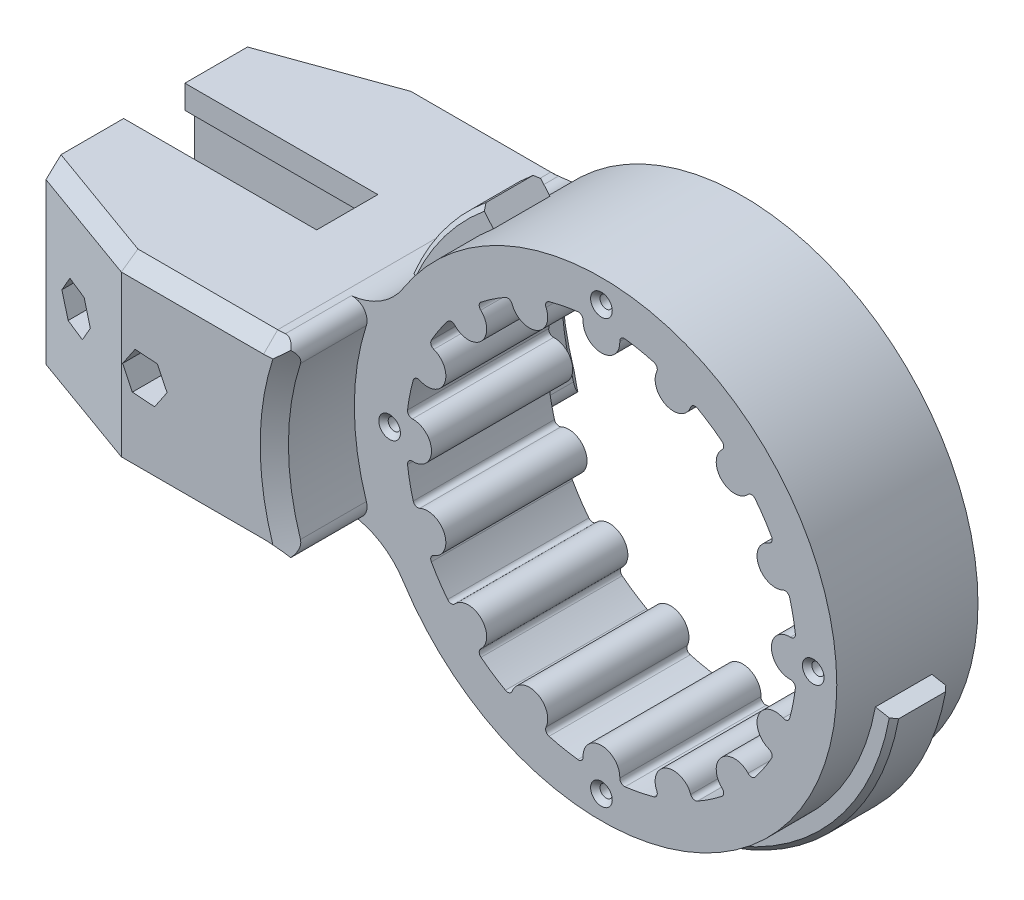
from build123d import *

# Parameters (mm, degrees)
SKETCH1_R           = 50
BOSS_EXTRUDE1_DEPTH = 30
BOSS_EXTRUDE2_DEPTH = 30
BOSS_EXTRUDE3_DEPTH = 17
BOSS_EXTRUDE4_START = 17
BOSS_EXTRUDE4_DEPTH = 17
SKETCH7_W           = 82
SKETCH7_H           = 12.999999999999998
CUT_EXTRUDE3_DEPTH  = 139.59653675326814
CUT_EXTRUDE4_DEPTH  = 139.59653675326814
FILLET3_R           = 15
CUT_EXTRUDE5_DEPTH  = 41
SKETCH11_R          = 2.750000000000008
CUT_EXTRUDE6_DEPTH  = 137.7333170810977
SKETCH12_R          = 4.599999999999999
SKETCH12_R_2        = 4.600000000000013
CUT_EXTRUDE7_DEPTH  = 12
CUT_EXTRUDE8_DEPTH  = 12
CHAMFER1_SIZE       = 3
CHAMFER2_SIZE       = 3
FILLET5_R           = 3
SKETCH17_R          = 1.3000000000000016
SKETCH17_R_2        = 1.3000000000000007
CUT_EXTRUDE10_DEPTH = 93.00000000000003
CHAMFER3_SIZE       = 1
SKETCH25_R          = 54.00000000000001
SKETCH25_R_2        = 50
BOSS_EXTRUDE8_DEPTH = 6
CUT_EXTRUDE12_START = -15
CUT_EXTRUDE12_DEPTH = 15
CHAMFER4_SIZE       = 1
CUT_EXTRUDE13_DEPTH = 132.24404756102277
FILLET6_R           = 1


with BuildPart() as part:
    # Sketch1 → Boss-Extrude1 (new body)
    with BuildSketch(Plane.XY):
        Circle(SKETCH1_R)
    extrude(amount=BOSS_EXTRUDE1_DEPTH)

    # Sketch4 → Boss-Extrude2 (add)
    with BuildSketch(Plane(origin=(0, 0, 0), x_dir=(-1, 0, 0), z_dir=(0, 0, -1))):
        with BuildLine():
            Line((45.825756949558404, -19.999999999999993), (110, -19.999999999999993))
            Line((110, -19.999999999999993), (110, 20.000000000000007))
            Line((110, 20.000000000000007), (45.8257569495584, 20.000000000000007))
            ThreePointArc((45.8257569495584, 20.000000000000007), (50, 8.33e-15), (45.825756949558404, -19.999999999999993))
        make_face()
    extrude(amount=-BOSS_EXTRUDE2_DEPTH)

    # Sketch5 → Boss-Extrude3 (add)
    with BuildSketch(Plane(origin=(0, 0, 0), x_dir=(-1, 0, 0), z_dir=(0, 0, -1))):
        with BuildLine():
            Line((110, -20), (110, 20))
            Line((110, 20), (48.541219597369, 20))
            ThreePointArc((48.541219597369, 20), (52.5, 0), (48.541219597369, -20))
            Line((48.541219597369, -20), (110, -20))
        make_face()
    extrude(amount=BOSS_EXTRUDE3_DEPTH)

    # Sketch6 → Boss-Extrude4 (add)
    with BuildSketch(Plane.XY.offset(30).offset(BOSS_EXTRUDE4_START)):
        with BuildLine():
            Line((-110, -20), (-48.541219597369, -20))
            ThreePointArc((-48.541219597369, -20), (-52.49999999999999, 6.43e-15), (-48.541219597368986, 20.00000000000001))
            Line((-48.541219597368986, 20.00000000000001), (-110.00000000000001, 20))
            Line((-110.00000000000001, 20), (-110, -20))
        make_face()
    extrude(amount=-BOSS_EXTRUDE4_DEPTH)

    # Sketch7 → Cut-Extrude3 (cut, through all)
    with BuildSketch(Plane(origin=(0, 20.000000000000007, 0), x_dir=(1, -1.3e-16, 0), z_dir=(1.3e-16, 1, 0))):
        with Locations((-110, -15)):
            Rectangle(SKETCH7_W, SKETCH7_H)
    extrude(amount=-CUT_EXTRUDE3_DEPTH, mode=Mode.SUBTRACT)

    # Sketch8 → Cut-Extrude4 (cut, through all)
    with BuildSketch(Plane(origin=(0, 20.000000000000007, 0), x_dir=(1, -1.3e-16, 0), z_dir=(1.3e-16, 1, 0))):
        Polygon((-110, 7.999999999999993), (-84.99999999999999, 16.999999999999996), (-110, 17), align=None)
        Polygon((-110.00000000000001, -38), (-85.00000000000001, -47), (-110.00000000000001, -47), align=None)
    extrude(amount=-CUT_EXTRUDE4_DEPTH, mode=Mode.SUBTRACT)

    # Fillet3
    # the kernel refuses this fillet: 15 mm, written as the material it adds along each edge
    with BuildSketch(Plane(origin=(-45.8257569495584, 20, -22.366247002395987), x_dir=(0.4706819799132327, 0.8823029376495123, 0), z_dir=(0, 0, 1))) as fillet3_piece_1_section:
        with BuildLine():
            CenterArc((9.023588295816216, 14.953751872461773), FILLET3_R, 208.07857443550242, 57.42102960719643)
            Line((-4.210955768926529, 7.893522173763395), (0, 0))
            ThreePointArc((0, 0), (3.9232992590505327, 0.154160425127419), (7.846598518101046, -5e-17))
        make_face()
    fillet3_piece_1 = extrude(amount=52.36624700239599, mode=Mode.PRIVATE)
    fillet3_piece_1 = split(fillet3_piece_1, bisect_by=Plane(origin=(-50.49351754230909, 20.262771786898075, 0), z_dir=(0, 0, -1)), keep=Keep.TOP, mode=Mode.PRIVATE)
    fillet3_piece_1 = split(fillet3_piece_1, bisect_by=Plane(origin=(-50.49351754230909, 20.262771786898075, -17), z_dir=(0, 0, 1)), keep=Keep.TOP, mode=Mode.PRIVATE)
    fillet3_piece_1 = fillet3_piece_1 - Plane(origin=(-3.197e-14, -8.9e-16, -8.499999999998765), x_dir=(-0.9245946589975046, 0.38095238095238115, 0), z_dir=(0, 0, 1)) * Cylinder(52.49999999999997, 137, mode=Mode.PRIVATE)
    add(fillet3_piece_1)
    with BuildSketch(Plane(origin=(-45.8257569495584, 20.000000000000007, 0), x_dir=(0.4706819799132331, 0.8823029376495122, 0), z_dir=(0, 0, 1))) as fillet3_piece_2_section:
        with BuildLine():
            CenterArc((9.023588295816205, 14.953751872461773), FILLET3_R, 208.07857443550242, 57.42102960719643)
            Line((-4.210955768926539, 7.89352217376339), (0, 0))
            ThreePointArc((0, 0), (3.923299259050527, 0.15416042512741726), (7.8465985181010405, -2.6e-16))
        make_face()
    fillet3_piece_2 = extrude(amount=30, mode=Mode.PRIVATE)
    fillet3_piece_2 = fillet3_piece_2 & Plane(origin=(-3.197e-14, -8.9e-16, 14.999999999999996), x_dir=(-0.9245946589975046, 0.38095238095238115, 0), z_dir=(0, 0, 1)) * Cylinder(52.49999999999997, 92, mode=Mode.PRIVATE)
    add(fillet3_piece_2)
    with BuildSketch(Plane(origin=(-45.8257569495584, 20.000000000000007, 0), x_dir=(0.4706819799132331, 0.8823029376495122, 0), z_dir=(0, 0, 1))) as fillet3_piece_3_section:
        with BuildLine():
            CenterArc((9.023588295816205, 14.953751872461773), FILLET3_R, 208.07857443550242, 57.42102960719643)
            Line((-4.210955768926539, 7.89352217376339), (0, 0))
            ThreePointArc((0, 0), (3.923299259050527, 0.15416042512741726), (7.8465985181010405, -2.6e-16))
        make_face()
    fillet3_piece_3 = extrude(amount=30, mode=Mode.PRIVATE)
    fillet3_piece_3 = fillet3_piece_3 - Plane(origin=(-3.197e-14, -8.9e-16, 15), x_dir=(-0.9245946589975046, 0.38095238095238115, 0), z_dir=(0, 0, 1)) * Cylinder(52.49999999999997, 92, mode=Mode.PRIVATE)
    add(fillet3_piece_3)
    with BuildSketch(Plane(origin=(-45.8257569495584, 20.000000000000007, 0), x_dir=(0.4706819799132331, 0.8823029376495122, 0), z_dir=(0, 0, 1))) as fillet3_piece_4_section:
        with BuildLine():
            CenterArc((9.023588295816205, 14.953751872461773), FILLET3_R, 208.07857443550242, 57.42102960719643)
            Line((-4.210955768926539, 7.89352217376339), (0, 0))
            ThreePointArc((0, 0), (3.923299259050527, 0.15416042512741726), (7.8465985181010405, -2.6e-16))
        make_face()
    fillet3_piece_4 = extrude(amount=52.366247002395994, mode=Mode.PRIVATE)
    fillet3_piece_4 = split(fillet3_piece_4, bisect_by=Plane(origin=(-50.49351754230926, 20.26277178689822, 30), z_dir=(0, 0, 1)), keep=Keep.TOP, mode=Mode.PRIVATE)
    fillet3_piece_4 = split(fillet3_piece_4, bisect_by=Plane(origin=(-50.49351754230926, 20.26277178689822, 47), z_dir=(0, 0, -1)), keep=Keep.TOP, mode=Mode.PRIVATE)
    fillet3_piece_4 = fillet3_piece_4 - Plane(origin=(-3.197e-14, -8.9e-16, 38.5), x_dir=(-0.9245946589975046, 0.38095238095238115, 0), z_dir=(0, 0, 1)) * Cylinder(52.49999999999997, 137, mode=Mode.PRIVATE)
    add(fillet3_piece_4)
    with BuildSketch(Plane(origin=(-45.825756949558404, -19.999999999999986, -22.366247002395934), x_dir=(0.4706819799132334, -0.882302937649512, 0), z_dir=(0, 0, 1))) as fillet3_piece_5_section:
        with BuildLine():
            CenterArc((9.023588295816205, -14.95375187246178), FILLET3_R, 94.50039595730111, 57.42102960719639)
            Line((-4.210955768926525, -7.8935221737633725), (0, 0))
            ThreePointArc((0, 0), (3.923299259050514, -0.1541604251274201), (7.846598518101049, -6e-17))
        make_face()
    fillet3_piece_5 = extrude(amount=52.36624700239594, mode=Mode.PRIVATE)
    fillet3_piece_5 = split(fillet3_piece_5, bisect_by=Plane(origin=(-50.49351754230909, -20.262771786898064, 0), z_dir=(0, 0, -1)), keep=Keep.TOP, mode=Mode.PRIVATE)
    fillet3_piece_5 = fillet3_piece_5 - Plane(origin=(-3.197e-14, -8.9e-16, -8.499999999998773), x_dir=(-0.9245946589975046, 0.38095238095238115, 0), z_dir=(0, 0, 1)) * Cylinder(52.49999999999997, 137, mode=Mode.PRIVATE)
    fillet3_piece_5 = split(fillet3_piece_5, bisect_by=Plane(origin=(-50.49351754230909, -20.262771786898064, -17), z_dir=(0, 0, 1)), keep=Keep.TOP, mode=Mode.PRIVATE)
    add(fillet3_piece_5)
    with BuildSketch(Plane(origin=(-45.825756949558404, -19.999999999999993, 0), x_dir=(0.47068197991323374, -0.8823029376495117, 0), z_dir=(0, 0, 1))) as fillet3_piece_6_section:
        with BuildLine():
            CenterArc((9.023588295816191, -14.95375187246178), FILLET3_R, 94.50039595730107, 57.421029607196374)
            Line((-4.210955768926534, -7.893522173763367), (0, 0))
            ThreePointArc((0, 0), (3.9232992590505074, -0.15416042512741837), (7.846598518101043, 9e-17))
        make_face()
    fillet3_piece_6 = extrude(amount=30, mode=Mode.PRIVATE)
    fillet3_piece_6 = fillet3_piece_6 & Plane(origin=(-3.197e-14, -8.9e-16, 15.000000000000002), x_dir=(-0.9245946589975046, 0.38095238095238115, 0), z_dir=(0, 0, 1)) * Cylinder(52.49999999999997, 92, mode=Mode.PRIVATE)
    add(fillet3_piece_6)
    with BuildSketch(Plane(origin=(-45.825756949558404, -19.999999999999993, 0), x_dir=(0.47068197991323374, -0.8823029376495117, 0), z_dir=(0, 0, 1))) as fillet3_piece_7_section:
        with BuildLine():
            CenterArc((9.023588295816191, -14.95375187246178), FILLET3_R, 94.50039595730107, 57.421029607196374)
            Line((-4.210955768926534, -7.893522173763367), (0, 0))
            ThreePointArc((0, 0), (3.9232992590505074, -0.15416042512741837), (7.846598518101043, 9e-17))
        make_face()
    fillet3_piece_7 = extrude(amount=30, mode=Mode.PRIVATE)
    fillet3_piece_7 = fillet3_piece_7 - Plane(origin=(-3.197e-14, -8.9e-16, 15.000000000000002), x_dir=(-0.9245946589975046, 0.38095238095238115, 0), z_dir=(0, 0, 1)) * Cylinder(52.49999999999997, 92, mode=Mode.PRIVATE)
    add(fillet3_piece_7)
    with BuildSketch(Plane(origin=(-45.825756949558404, -19.999999999999993, 0), x_dir=(0.47068197991323374, -0.8823029376495117, 0), z_dir=(0, 0, 1))) as fillet3_piece_8_section:
        with BuildLine():
            CenterArc((9.023588295816191, -14.95375187246178), FILLET3_R, 94.50039595730107, 57.421029607196374)
            Line((-4.210955768926534, -7.893522173763367), (0, 0))
            ThreePointArc((0, 0), (3.9232992590505074, -0.15416042512741837), (7.846598518101043, 9e-17))
        make_face()
    fillet3_piece_8 = extrude(amount=52.36624700239594, mode=Mode.PRIVATE)
    fillet3_piece_8 = split(fillet3_piece_8, bisect_by=Plane(origin=(-50.493517542309256, -20.262771786898217, 30), z_dir=(0, 0, 1)), keep=Keep.TOP, mode=Mode.PRIVATE)
    fillet3_piece_8 = fillet3_piece_8 - Plane(origin=(-3.197e-14, -8.9e-16, 38.5), x_dir=(-0.9245946589975046, 0.38095238095238115, 0), z_dir=(0, 0, 1)) * Cylinder(52.49999999999997, 137, mode=Mode.PRIVATE)
    fillet3_piece_8 = split(fillet3_piece_8, bisect_by=Plane(origin=(-50.493517542309256, -20.262771786898217, 47), z_dir=(0, 0, -1)), keep=Keep.TOP, mode=Mode.PRIVATE)
    add(fillet3_piece_8)

    # Sketch10 → Cut-Extrude5 (cut)
    with BuildSketch(Plane.ZY.offset(110)):
        Polygon((6.500000000000009, 15.000000000000007), (23.499999999999993, 15.000000000000005), (23.499999999999993, -14.999999999999998), (6.500000000000009, -14.999999999999993), align=None)
    extrude(amount=-CUT_EXTRUDE5_DEPTH, mode=Mode.SUBTRACT)

    # Sketch11 → Cut-Extrude6 (cut, through all)
    with BuildSketch(Plane(origin=(0, 0, -17), x_dir=(-1, 0, 0), z_dir=(0, 0, -1))):
        with Locations((100.00000000000001, -3.67e-15)):
            Circle(SKETCH11_R)
        with Locations((80.00000000000001, -6.12e-15)):
            Circle(SKETCH11_R)
    extrude(amount=-CUT_EXTRUDE6_DEPTH, mode=Mode.SUBTRACT)

    # Sketch12 → Cut-Extrude7 (cut)
    with BuildSketch(Plane(origin=(0, 0, -17), x_dir=(-1, 0, 0), z_dir=(0, 0, -1))):
        with Locations((80.00000000000001, -6.12e-15)):
            Circle(SKETCH12_R)
        with Locations((100.00000000000001, -3.67e-15)):
            Circle(SKETCH12_R_2)
    extrude(amount=-CUT_EXTRUDE7_DEPTH, mode=Mode.SUBTRACT)

    # Sketch13 → Cut-Extrude8 (cut)
    with BuildSketch(Plane.XY.offset(47)):
        Polygon((-104.72243583501142, 0.33456407089449847), (-102.65095890209392, -3.9224673654145854), (-97.92852306708252, -4.257031436309101), (-95.27756416498866, -0.33456407089451495), (-97.34904109790615, 3.922467365414601), (-102.07147693291752, 4.2570314363091155), align=None)
        Polygon((-84.72243583501141, 0.3345640708945193), (-82.6509589020939, -3.9224673654145708), (-77.92852306708252, -4.257031436309093), (-75.27756416498863, -0.3345640708945236), (-77.34904109790615, 3.922467365414575), (-82.07147693291752, 4.257031436309095), align=None)
    extrude(amount=-CUT_EXTRUDE8_DEPTH, mode=Mode.SUBTRACT)

    # Chamfer1
    chamfer1_edges = [part.edges().sort_by_distance(p)[0] for p in [
        (-51.179484310863074, 20.43662149834451, 47),
        (-51.17948431086295, -20.436621498344543, 47),
        (-52.5, 1.066e-14, 47),
        (-69.88612787525821, -20, 47),
        (-97.5, -19.999999999999993, 42.49999999999999),
        (-97.50000000000001, 20.00000000000002, 42.5),
        (-69.88612787525827, 20.000000000000007, 47),
    ]]
    chamfer(chamfer1_edges, length=CHAMFER1_SIZE)

    # Chamfer2
    chamfer2_edges = [part.edges().sort_by_distance(p)[0] for p in [
        (-51.17948431086295, -20.436621498344543, -17),
        (-52.5, 9.77e-15, -17),
        (-69.88612787525827, 20, -17),
        (-97.49999999999999, -19.999999999999993, -12.499999999999996),
        (-97.5, 20.00000000000002, -12.499999999999995),
        (-69.8861278752582, -20, -17),
        (-51.179484310863074, 20.43662149834451, -17),
    ]]
    chamfer(chamfer2_edges, length=CHAMFER2_SIZE)

    # Fillet5
    fillet5_edges = [part.edges().sort_by_distance(p)[0] for p in [
        (-47.79587037110309, -21.721067549011234, -7),
        (-47.79587037110309, -21.721067549011234, 37),
        (-47.79587037110309, 21.721067549011234, -7),
        (-47.79587037110309, 21.721067549011234, 37),
    ]]
    fillet(fillet5_edges, radius=FILLET5_R)

    # Sketch17 → Cut-Extrude10 (cut)
    with BuildSketch(Plane.XY.offset(30)):
        with Locations((-45, 0)):
            Circle(SKETCH17_R)
        with Locations((-2.76e-15, 45)):
            Circle(SKETCH17_R_2)
        with Locations((45, 5.51e-15)):
            Circle(SKETCH17_R)
        with Locations((8.27e-15, -45)):
            Circle(SKETCH17_R_2)
    extrude(amount=-CUT_EXTRUDE10_DEPTH, mode=Mode.SUBTRACT)

    # Chamfer3
    chamfer3_edges = [part.edges().sort_by_distance(p)[0] for p in [
        (-46.300000000000004, -4.2e-16, 30),
        (-1.3000000000000034, 45, 30),
        (43.699999999999996, 5.09e-15, 30),
        (-1.2999999999999925, -45, 30),
    ]]
    chamfer(chamfer3_edges, length=CHAMFER3_SIZE)

    # Sketch25 → Boss-Extrude8 (add, symmetric)
    with BuildSketch(Plane.XY.offset(15)):
        Circle(SKETCH25_R)
        Circle(SKETCH25_R_2, mode=Mode.SUBTRACT)
    extrude(amount=BOSS_EXTRUDE8_DEPTH, both=True)

    # Sketch26 → Cut-Extrude12 (cut)
    with BuildSketch(Plane.XY.offset(20.999999999999996).offset(CUT_EXTRUDE12_START)):
        with BuildLine():
            Line((53.13418555816767, -9.631112348540338), (49.198319961266364, -8.91769661901883))
            ThreePointArc((49.198319961266364, -8.91769661901883), (25.20671015183375, 43.181266346894475), (-31.95591472346896, 38.455422428916066))
            Line((-31.95591472346896, 38.455422428916066), (-34.51238790134648, 41.53185622322934))
            ThreePointArc((-34.51238790134648, 41.53185622322934), (27.22324696398045, 46.63576765464603), (53.13418555816767, -9.631112348540338))
        make_face()
    extrude(amount=CUT_EXTRUDE12_DEPTH, mode=Mode.SUBTRACT)

    # Chamfer4
    chamfer4_edges = [part.edges().sort_by_distance(p)[0] for p in [
        (5.846200759408857, -53.6826036689791, 21),
        (5.8462007594098395, -53.68260366897899, 9),
        (-43.414386383861704, 32.11216365978419, 9),
        (-43.41438638386222, 32.1121636597835, 21),
    ]]
    chamfer(chamfer4_edges, length=CHAMFER4_SIZE)

    # Sketch27 → Cut-Extrude13 (cut, through all)
    with BuildSketch(Plane.XY.offset(30)):
        with BuildLine():
            ThreePointArc((-41.33799999999999, -3.6632985136349734), (-36.09999999999998, 0), (-41.33799999999999, 3.6632985136349734))
            ThreePointArc((-41.33799999999999, 3.6632985136349734), (-40.70258913673405, 8.096248363669334), (-39.59321576392731, 12.43492120888174))
            ThreePointArc((-39.59321576392731, 12.43492120888174), (-33.352051123657425, 13.814871908379772), (-36.78944846597579, 19.203814245334485))
            ThreePointArc((-36.78944846597579, 19.203814245334485), (-34.505988910555594, 23.056164670313528), (-31.820723341191343, 26.64003690018766))
            ThreePointArc((-31.820723341191343, 26.64003690018766), (-25.526554800835093, 25.526554800833708), (-26.640036900188544, 31.820723341190607))
            ThreePointArc((-26.640036900188544, 31.820723341190607), (-23.05616467031391, 34.505988910555345), (-19.203814245334275, 36.789448465975894))
            ThreePointArc((-19.203814245334275, 36.789448465975894), (-13.814871908380718, 33.352051123656665), (-12.434921208883269, 39.59321576392684))
            ThreePointArc((-12.434921208883269, 39.59321576392684), (-8.096248363670052, 40.70258913673391), (-3.663298513634829, 41.338))
            ThreePointArc((-3.663298513634829, 41.338), (-1.12863e-12, 36.09999999999883), (3.6632985136331393, 41.338000000000164))
            ThreePointArc((3.6632985136331393, 41.338000000000164), (8.096248363668556, 40.70258913673421), (12.434921208881963, 39.59321576392725))
            ThreePointArc((12.434921208881963, 39.59321576392725), (13.814871908378183, 33.35205112365597), (19.20381424533285, 36.78944846597663))
            ThreePointArc((19.20381424533285, 36.78944846597663), (23.056164670312832, 34.505988910556056), (26.64003690018777, 31.820723341191243))
            ThreePointArc((26.64003690018777, 31.820723341191243), (25.526554800832038, 25.526554800832546), (31.820723341190405, 26.640036900188786))
            ThreePointArc((31.820723341190405, 26.640036900188786), (34.50598891055528, 23.05616467031398), (36.78944846597595, 19.203814245334144))
            ThreePointArc((36.78944846597595, 19.203814245334144), (33.35205112365423, 13.814871908378157), (39.59321576392702, 12.434921208882718))
            ThreePointArc((39.59321576392702, 12.434921208882718), (40.70258913673413, 8.096248363668986), (41.33800000000015, 3.663298513633235))
            ThreePointArc((41.33800000000015, 3.663298513633235), (36.09999999999716, -3.912e-13), (41.33799999999996, -3.6632985136352625))
            ThreePointArc((41.33799999999996, -3.6632985136352625), (40.70258913673382, -8.096248363670547), (39.59321576392667, -12.434921208883813))
            ThreePointArc((39.59321576392667, -12.434921208883813), (33.35205112365465, -13.81487190837967), (36.78944846597569, -19.203814245334666))
            ThreePointArc((36.78944846597569, -19.203814245334666), (34.50598891055488, -23.056164670314615), (31.820723341189822, -26.64003690018949))
            ThreePointArc((31.820723341189822, -26.64003690018949), (25.526554800831782, -25.52655480083383), (26.640036900187322, -31.82072334119162))
            ThreePointArc((26.640036900187322, -31.82072334119162), (23.05616467031232, -34.50598891055641), (19.203814245332282, -36.78944846597694))
            ThreePointArc((19.203814245332282, -36.78944846597694), (13.814871908377526, -33.352051123656544), (12.43492120888131, -39.593215763927454))
            ThreePointArc((12.43492120888131, -39.593215763927454), (8.096248363668016, -40.702589136734325), (3.6632985136327427, -41.33800000000019))
            ThreePointArc((3.6632985136327427, -41.33800000000019), (-1.75086e-12, -36.09999999999889), (-3.6632985136354064, -41.33799999999996))
            ThreePointArc((-3.6632985136354064, -41.33799999999996), (-8.096248363670433, -40.70258913673385), (-12.434921208883452, -39.59321576392679))
            ThreePointArc((-12.434921208883452, -39.59321576392679), (-13.814871908380951, -33.35205112365632), (-19.203814245334854, -36.7894484659756))
            ThreePointArc((-19.203814245334854, -36.7894484659756), (-23.05616467031393, -34.50598891055534), (-26.64003690018806, -31.82072334119101))
            ThreePointArc((-26.64003690018806, -31.82072334119101), (-25.52655480083471, -25.526554800834095), (-31.820723341191652, -26.640036900187287))
            ThreePointArc((-31.820723341191652, -26.640036900187287), (-34.505988910555885, -23.05616467031308), (-36.78944846597605, -19.20381424533395))
            ThreePointArc((-36.78944846597605, -19.20381424533395), (-33.352051123657624, -13.814871908379276), (-39.59321576392749, -12.434921208881171))
            ThreePointArc((-39.59321576392749, -12.434921208881171), (-40.702589136734105, -8.096248363669046), (-41.33799999999999, -3.6632985136349734))
        make_face()
    extrude(amount=-CUT_EXTRUDE13_DEPTH, mode=Mode.SUBTRACT)

    # Fillet6
    fillet6_edges = [part.edges().sort_by_distance(p)[0] for p in [
        (-39.593215763927496, -12.43492120888117, 15),
        (-41.33799999999999, -3.6632985136349725, 15),
        (-41.33799999999999, 3.663298513634974, 15),
        (-39.593215763927304, 12.43492120888174, 15),
        (-36.78944846597579, 19.203814245334485, 15),
        (-31.820723341191346, 26.64003690018766, 15),
        (-26.640036900188548, 31.820723341190607, 15),
        (-19.20381424533428, 36.7894484659759, 15),
        (-12.43492120888327, 39.593215763926835, 15),
        (-3.6632985136348264, 41.338, 15),
        (3.6632985136331393, 41.338000000000164, 15),
        (12.434921208881963, 39.59321576392725, 15),
        (19.20381424533285, 36.78944846597663, 15),
        (26.64003690018777, 31.820723341191247, 15),
        (31.820723341190405, 26.64003690018879, 15),
        (36.78944846597595, 19.203814245334144, 15),
        (39.59321576392702, 12.434921208882717, 15),
        (41.33800000000015, 3.663298513633237, 15),
        (41.337999999999965, -3.6632985136352625, 15),
        (39.59321576392668, -12.434921208883814, 15),
        (36.78944846597569, -19.20381424533467, 15),
        (31.820723341189826, -26.640036900189493, 15),
        (26.640036900187326, -31.820723341191616, 15),
        (19.203814245332282, -36.789448465976946, 15),
        (12.43492120888131, -39.59321576392746, 15),
        (3.663298513632742, -41.3380000000002, 15),
        (-3.663298513635409, -41.337999999999965, 15),
        (-12.434921208883456, -39.5932157639268, 15),
        (-19.203814245334854, -36.7894484659756, 15),
        (-26.640036900188058, -31.82072334119101, 15),
        (-31.820723341191652, -26.640036900187287, 15),
        (-36.78944846597605, -19.203814245333948, 15),
    ]]
    fillet(fillet6_edges, radius=FILLET6_R)


solid = part.part
